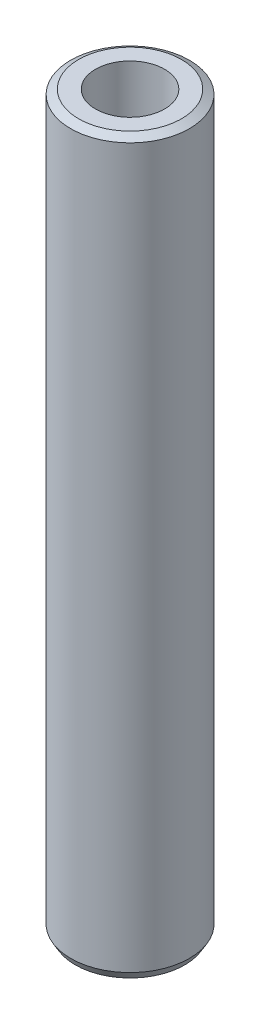
from build123d import *
from OCP.BRepFilletAPI import BRepFilletAPI_MakeChamfer

# Parameters (mm, degrees)
SKETCH1_R           = 7.5
BOSS_EXTRUDE1_DEPTH = 92.361005361
SKETCH2_R           = 4.361391526
CUT_EXTRUDE1_DEPTH  = 93.968033814
CHAMFER1_SIZE       = 0.578789865
CHAMFER1_SIZE2      = 1.002493454


with BuildPart() as part:
    # Sketch1 → Boss-Extrude1 (new body)
    with BuildSketch(Plane(origin=(0, 0, 0), x_dir=(1, 0, 0), z_dir=(0, 1, 0))):
        Circle(SKETCH1_R)
    extrude(amount=BOSS_EXTRUDE1_DEPTH)

    # Sketch2 → Cut-Extrude1 (cut, through all)
    with BuildSketch(Plane(origin=(0, 0, 0), x_dir=(1, 0, 0), z_dir=(0, 1, 0))):
        Circle(SKETCH2_R)
    extrude(amount=CUT_EXTRUDE1_DEPTH, mode=Mode.SUBTRACT)

    # Chamfer1: one chamfer whose edges measure the first distance from different faces: ONE call of the kernel's chamfer builder (chamfer() names one face for all edges)
    chamfer1_edges_1 = [part.edges().sort_by_distance(p)[0] for p in [
        (-7.5, 92.361005361, 0),
    ]]
    chamfer1_side_1 = [part.faces().sort_by_distance(p)[0] for p in [
        (-7.5, 46.18050268, 0),
    ]]
    chamfer1_edges_2 = [part.edges().sort_by_distance(p)[0] for p in [
        (-7.5, 0, 0),
    ]]
    chamfer1_side_2 = [part.faces().sort_by_distance(p)[0] for p in [
        (-7.287867966, 0, 0),
    ]]
    chamfer1 = BRepFilletAPI_MakeChamfer(part.part.solid().wrapped)
    for e in chamfer1_edges_1:
        chamfer1.Add(CHAMFER1_SIZE, CHAMFER1_SIZE2, e.wrapped, chamfer1_side_1[0].wrapped)  # the first distance lies on this face
    for e in chamfer1_edges_2:
        chamfer1.Add(CHAMFER1_SIZE, CHAMFER1_SIZE2, e.wrapped, chamfer1_side_2[0].wrapped)  # the first distance lies on this face
    add(Compound.cast(chamfer1.Shape()), mode=Mode.REPLACE)


solid = part.part
